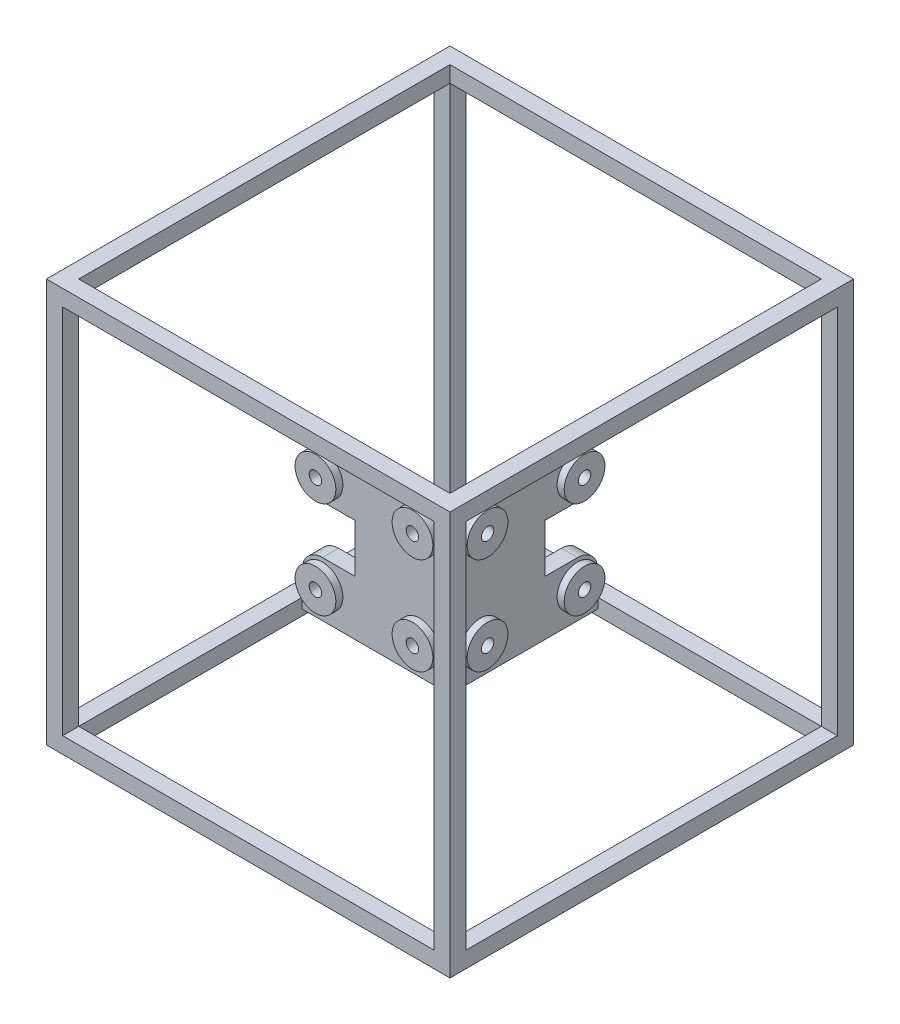
from build123d import *

# Parameters (mm, degrees)
SKETCH1_W              = 100
SKETCH1_H              = 100
SKETCH1_W_2            = 92
SKETCH1_H_2            = 92
BOSS_EXTRUDE1_DEPTH    = 4
SKETCH9_W              = 100
SKETCH9_H              = 100
SKETCH9_W_2            = 92
SKETCH9_H_2            = 92
BOSS_EXTRUDE2_DEPTH    = 4
SKETCH10_W             = 100
SKETCH10_H             = 100
SKETCH10_W_2           = 92
SKETCH10_H_2           = 92
BOSS_EXTRUDE3_DEPTH    = 4
SKETCH11_R             = 5.05
SKETCH11_R_2           = 1.55
BOSS_EXTRUDE13_DEPTH   = 1.75
BOSS_EXTRUDE13_2_DEPTH = 1.75
BOSS_EXTRUDE13_3_DEPTH = 1.75
BOSS_EXTRUDE13_4_DEPTH = 1.75
SKETCH12_R             = 1.55
BOSS_EXTRUDE6_DEPTH    = 4
BODY_MOVE_COPY1_ANGLE  = 180
BODY_MOVE_COPY3_ANGLE  = 120
BOSS_EXTRUDE7_DEPTH    = 36.64081528
CUT_EXTRUDE1_START     = -4
SKETCH18_R             = 1.55
SKETCH18_W             = 13.07081528
SKETCH18_H             = 12
CUT_EXTRUDE1_DEPTH     = 2.499185
CUT_EXTRUDE2_START     = -4
SKETCH19_R             = 1.55
SKETCH19_W             = 13.07081528
SKETCH19_H             = 12
CUT_EXTRUDE2_DEPTH     = 2.499185
FILLET2_R              = 5.05
CHAMFER1_SIZE          = 1.35


with BuildPart() as part:
    # Sketch1 → Boss-Extrude1 (new body)
    with BuildSketch(Plane.XY.offset(50)):
        Rectangle(SKETCH1_W, SKETCH1_H)
        Rectangle(SKETCH1_W_2, SKETCH1_H_2, mode=Mode.SUBTRACT)
    extrude(amount=-BOSS_EXTRUDE1_DEPTH)


with BuildPart() as body_2:
    # Mirror2: mirrored copy
    add(part.part.mirror(Plane.XY))


with BuildPart() as part_1:
    add(part.part)

    add(body_2.part)  # Boss-Extrude2 merges body 2
    # Sketch9 → Boss-Extrude2 (add)
    with BuildSketch(Plane(origin=(50, 0, 0), x_dir=(0, 0, -1), z_dir=(1, 0, 0))):
        Rectangle(SKETCH9_W, SKETCH9_H)
        Rectangle(SKETCH9_W_2, SKETCH9_H_2, mode=Mode.SUBTRACT)
    boss_extrude2 = extrude(amount=-BOSS_EXTRUDE2_DEPTH)

    # Mirror3: Boss-Extrude2 across plane
    add(boss_extrude2.mirror(Plane(origin=(0, 0, 0), x_dir=(0, 0, 1), z_dir=(1, 0, 0))))

    # Sketch10 → Boss-Extrude3 (add)
    with BuildSketch(Plane(origin=(0, 50, 0), x_dir=(1, 0, 0), z_dir=(0, 1, 0))):
        Rectangle(SKETCH10_W, SKETCH10_H)
        Rectangle(SKETCH10_W_2, SKETCH10_H_2, mode=Mode.SUBTRACT)
    boss_extrude3 = extrude(amount=-BOSS_EXTRUDE3_DEPTH)

    # Mirror4: Boss-Extrude3 across plane
    add(boss_extrude3.mirror(Plane.ZX))


with BuildPart() as body_2_2:
    # Sketch11 → Boss-Extrude13 (new body)
    with BuildSketch(Plane.ZY.offset(-21.32)):
        with Locations(Location((-12.02081528, 12.02081528, 0), (0, 0, 270))):
            Circle(SKETCH11_R)
        with Locations(Location((-12.02081528, 12.02081528, 0), (0, 0, 270))):
            Circle(SKETCH11_R_2, mode=Mode.SUBTRACT)
    extrude(amount=BOSS_EXTRUDE13_DEPTH)



with BuildPart() as body_3:
    # Sketch11 → Boss-Extrude13 2 (new body)
    with BuildSketch(Plane.ZY.offset(-21.32)):
        with Locations(Location((12.02081528, 12.02081528, 0), (0, 0, 270))):
            Circle(SKETCH11_R)
        with Locations(Location((12.02081528, 12.02081528, 0), (0, 0, 270))):
            Circle(SKETCH11_R_2, mode=Mode.SUBTRACT)
    extrude(amount=BOSS_EXTRUDE13_2_DEPTH)


with BuildPart() as body_4:
    # Sketch11 → Boss-Extrude13 3 (new body)
    with BuildSketch(Plane.ZY.offset(-21.32)):
        with Locations(Location((12.02081528, -12.02081528, 0), (0, 0, 270))):
            Circle(SKETCH11_R)
        with Locations(Location((12.02081528, -12.02081528, 0), (0, 0, 270))):
            Circle(SKETCH11_R_2, mode=Mode.SUBTRACT)
    extrude(amount=BOSS_EXTRUDE13_3_DEPTH)


with BuildPart() as body_5:
    # Sketch11 → Boss-Extrude13 4 (new body)
    with BuildSketch(Plane.ZY.offset(-21.32)):
        with Locations(Location((-12.02081528, -12.02081528, 0), (0, 0, 270))):
            Circle(SKETCH11_R)
        with Locations(Location((-12.02081528, -12.02081528, 0), (0, 0, 270))):
            Circle(SKETCH11_R_2, mode=Mode.SUBTRACT)
    extrude(amount=BOSS_EXTRUDE13_4_DEPTH)


with BuildPart() as body_2_2_1:
    add(body_2_2.part)

    add(body_3.part)  # Boss-Extrude6 merges body 3

    add(body_4.part)  # Boss-Extrude6 merges body 4

    add(body_5.part)  # Boss-Extrude6 merges body 5
    # Sketch12 → Boss-Extrude6 (add)
    with BuildSketch(Plane.ZY.offset(-19.57)):
        Polygon((17.07081528, -17.07081528), (17.07081528, 17.07081528), (-17.07081528, 17.07081528), (-17.07081528, 6), (-4, 6), (-4, -6), (-17.07081528, -6), (-17.07081528, -17.07081528), align=None)
        with Locations(Location((-12.02081528, -12.02081528, 0), (0, 0, 270))):
            Circle(SKETCH12_R, mode=Mode.SUBTRACT)
        with Locations(Location((12.02081528, -12.02081528, 0), (0, 0, 270))):
            Circle(SKETCH12_R, mode=Mode.SUBTRACT)
        with Locations(Location((12.02081528, 12.02081528, 0), (0, 0, 270))):
            Circle(SKETCH12_R, mode=Mode.SUBTRACT)
        with Locations(Location((-12.02081528, 12.02081528, 0), (0, 0, 270))):
            Circle(SKETCH12_R, mode=Mode.SUBTRACT)
    extrude(amount=BOSS_EXTRUDE6_DEPTH)


with BuildPart() as body_3_2:
    # Body-Move/Copy1: copy of body 2 2
    add(body_2_2_1.part.moved(Location((0, 0, 0))).rotate(Axis((9.285, 0, -9.285), (0.7071067811865488, 0, 0.7071067811865462)), BODY_MOVE_COPY1_ANGLE))


with BuildPart() as body_3_2_1:
    # Body-Move/Copy2: moved
    add(body_3_2.part.moved(Location((-18.57, 0, 18.57))))


with BuildPart() as body_4_2:
    # Body-Move/Copy3: copy of body 3 2
    add(body_3_2_1.part.moved(Location((0, 0, 0))).rotate(Axis((-6.19, 6.19, 12.38), (0.5773502691896252, -0.5773502691896252, 0.5773502691896272)), BODY_MOVE_COPY3_ANGLE))


with BuildPart() as body_4_2_1:
    # Body-Move/Copy4: moved
    add(body_4_2.part.moved(Location((0, -18.57, -18.57))))

    # Combine1: union body 3 2, body 2 2
    add(body_3_2_1.part)
    add(body_2_2_1.part)

    # Sketch13 → Boss-Extrude7 (add)
    with BuildSketch(Plane.XZ.offset(19.57)):
        Polygon((19.57, 19.57), (-17.07081528, 19.57), (-17.07081528, 17.07081528), (17.07081528, 17.07081528), (17.07081528, -17.07081528), (19.57, -17.07081528), (19.57, 17.07081528), align=None)
    extrude(amount=-BOSS_EXTRUDE7_DEPTH)

    # Sketch18 → Cut-Extrude1 (cut)
    with BuildSketch(Plane(origin=(0, 0, 15.57), x_dir=(-1, 0, 0), z_dir=(0, 0, -1)).offset(CUT_EXTRUDE1_START)):
        with Locations(Location((-12.02081528, 12.02081528, 0), (0, 0, 90))):
            Circle(SKETCH18_R)
        with Locations(Location((12.02081528, 12.02081528, 0), (0, 0, 90))):
            Circle(SKETCH18_R)
        with Locations(Location((12.02081528, -12.02081528, 0), (0, 0, 90))):
            Circle(SKETCH18_R)
        with Locations(Location((-12.02081528, -12.02081528, 0), (0, 0, 90))):
            Circle(SKETCH18_R)
        with Locations((10.53540764, 0)):
            Rectangle(SKETCH18_W, SKETCH18_H)
    extrude(amount=CUT_EXTRUDE1_DEPTH, mode=Mode.SUBTRACT)

    # Sketch19 → Cut-Extrude2 (cut)
    with BuildSketch(Plane.ZY.offset(-15.57).offset(CUT_EXTRUDE2_START)):
        with Locations(Location((-12.02081528, 12.02081528, 0), (0, 0, 270))):
            Circle(SKETCH19_R)
        with Locations(Location((12.02081528, 12.02081528, 0), (0, 0, 270))):
            Circle(SKETCH19_R)
        with Locations(Location((12.02081528, -12.02081528, 0), (0, 0, 270))):
            Circle(SKETCH19_R)
        with Locations(Location((-12.02081528, -12.02081528, 0), (0, 0, 270))):
            Circle(SKETCH19_R)
        with Locations((-10.53540764, 0)):
            Rectangle(SKETCH19_W, SKETCH19_H)
    extrude(amount=CUT_EXTRUDE2_DEPTH, mode=Mode.SUBTRACT)

    # Fillet2
    fillet2_edges = [body_4_2_1.edges().sort_by_distance(p)[0] for p in [
        (17.57, -6, -17.07081528),
        (-17.07081528, 6, 17.57),
        (-17.07081528, 17.07081528, 17.57),
        (-17.07081528, -6, 17.57),
        (17.57, 17.07081528, -17.07081528),
        (17.57, 6, -17.07081528),
        (-6, -17.57, -17.07081528),
        (-17.07081528, -17.57, -17.07081528),
        (6, -17.57, -17.07081528),
    ]]
    fillet(fillet2_edges, radius=FILLET2_R - 0.0001)  # a hair under: the kernel refuses the full size

    # Chamfer1
    chamfer1_edges = [body_4_2_1.edges().sort_by_distance(p)[0] for p in [
        (-12.02081528, 10.47081528, 15.57),
        (12.02081528, 10.47081528, 15.57),
        (12.02081528, -13.57081528, 15.57),
        (-12.02081528, -13.57081528, 15.57),
        (15.57, -10.47081528, -12.02081528),
        (15.57, -10.47081528, 12.02081528),
        (15.57, 13.57081528, 12.02081528),
        (15.57, 13.57081528, -12.02081528),
        (-10.47081528, -15.57, -12.02081528),
        (-10.47081528, -15.57, 12.02081528),
        (13.57081528, -15.57, 12.02081528),
        (13.57081528, -15.57, -12.02081528),
    ]]
    chamfer(chamfer1_edges, length=CHAMFER1_SIZE)


solid = Compound([part_1.part, body_4_2_1.part])
